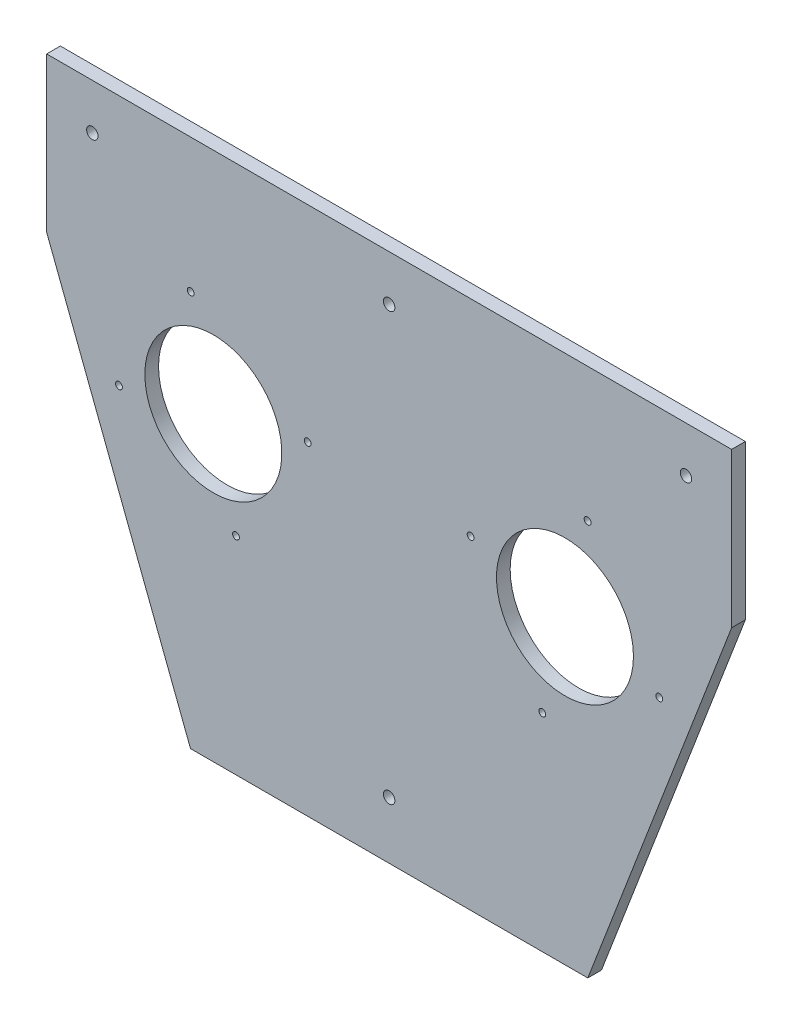
from build123d import *

# Parameters (mm, degrees)
SKETCH1_R           = 2.5
BOSS_EXTRUDE1_DEPTH = 6
SKETCH2_R           = 1.5
SKETCH2_R_2         = 30
CUT_EXTRUDE1_DEPTH  = 10


with BuildPart() as part:
    # Sketch1 → Boss-Extrude1 (new body)
    with BuildSketch(Plane.XY):
        Polygon((-150, 45.838066193), (-87, -118.5), (87, -118.5), (150, 45.838066193), (150, 113.5), (-150, 113.5), align=None)
        with Locations((0, -93.5)):
            Circle(SKETCH1_R, mode=Mode.SUBTRACT)
        with Locations((0, 93.5)):
            Circle(SKETCH1_R, mode=Mode.SUBTRACT)
        with Locations((-130, 93.5)):
            Circle(SKETCH1_R, mode=Mode.SUBTRACT)
        with Locations((130, 93.5)):
            Circle(SKETCH1_R, mode=Mode.SUBTRACT)
    extrude(amount=BOSS_EXTRUDE1_DEPTH)

    # Sketch2 → Cut-Extrude1 (cut)
    with BuildSketch(Plane.XY.offset(6)):
        with Locations((35.67402397, 23.420368197)):
            Circle(SKETCH2_R)
        with Locations((86.920368197, 54.82597603)):
            Circle(SKETCH2_R)
        with Locations((118.32597603, 3.579631803)):
            Circle(SKETCH2_R)
        with Locations((67.079631803, -27.82597603)):
            Circle(SKETCH2_R)
        with Locations((77, 13.5)):
            Circle(SKETCH2_R_2)
        with Locations((-35.67402397, 23.420368197)):
            Circle(SKETCH2_R)
        with Locations((-86.920368197, 54.82597603)):
            Circle(SKETCH2_R)
        with Locations((-67.079631803, -27.82597603)):
            Circle(SKETCH2_R)
        with Locations((-118.32597603, 3.579631803)):
            Circle(SKETCH2_R)
        with Locations((-77, 13.5)):
            Circle(SKETCH2_R_2)
    extrude(amount=-CUT_EXTRUDE1_DEPTH, mode=Mode.SUBTRACT)


solid = part.part
